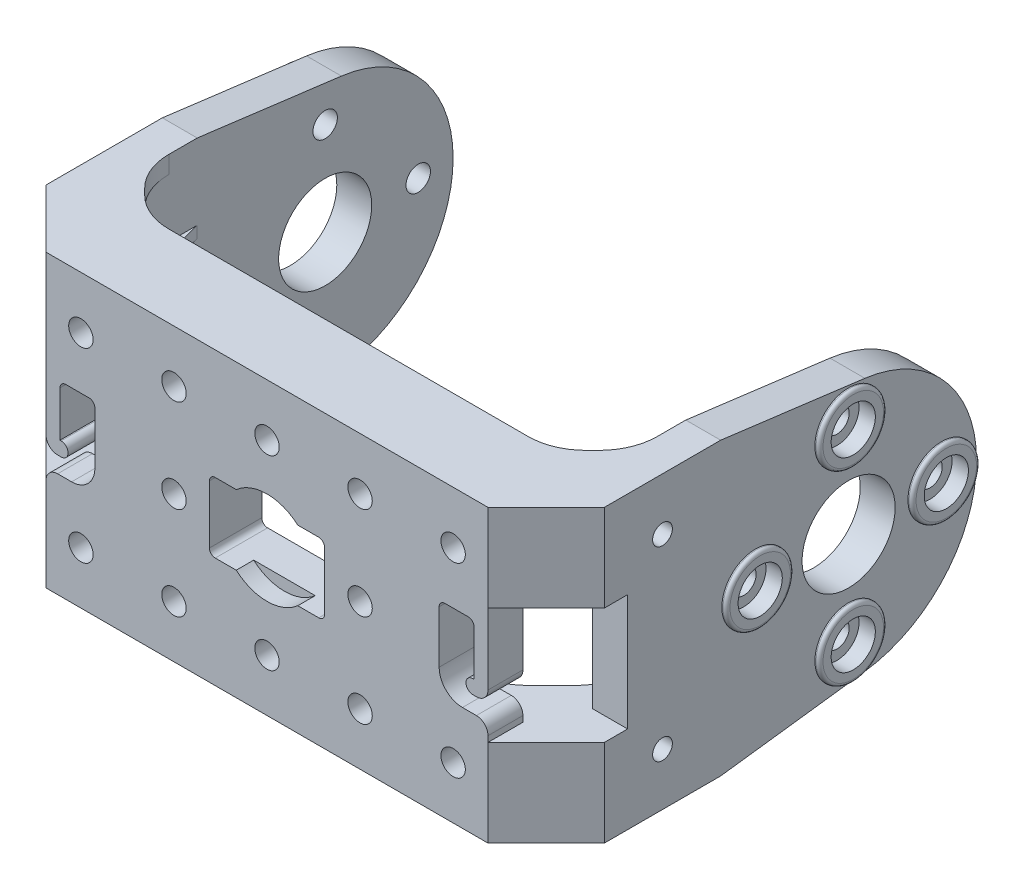
from build123d import *

# Parameters (mm, degrees)
BOSS_EXTRUDE1_DEPTH            = 1
BOSS_EXTRUDE2_DEPTH            = 0.5
CUT_EXTRUDE1_DEPTH             = 1
CUT_EXTRUDE2_DEPTH             = 1
CUT_EXTRUDE3_DEPTH             = 1
SKETCH6_W                      = 1.5
SKETCH6_H                      = 1.5
BOSS_EXTRUDE3_DEPTH            = 10.919112181
CUT_EXTRUDE4_DEPTH             = 1
BOSS_EXTRUDE4_DEPTH            = 7.5
BOSS_EXTRUDE5_DEPTH            = 7.5
CUT_EXTRUDE5_DEPTH             = 6
CUT_EXTRUDE6_DEPTH             = 6
BOSS_EXTRUDE6_DEPTH            = 3
BOSS_EXTRUDE7_START            = 3
BOSS_EXTRUDE7_DEPTH            = 3
CUT_EXTRUDE7_DEPTH             = 1.5
CUT_EXTRUDE8_DEPTH             = 1.5
CUT_EXTRUDE9_DEPTH             = 5
SKETCH17_W                     = 0.5
SKETCH17_H                     = 7
CUT_EXTRUDE10_DEPTH            = 1.743065645
CUT_EXTRUDE11_DEPTH            = 1.5
CUT_EXTRUDE12_DEPTH            = 1.5
CUT_EXTRUDE13_DEPTH            = 5
SKETCH21_W                     = 0.5
SKETCH21_H                     = 7
CUT_EXTRUDE14_DEPTH            = 2.337822174
SKETCH22_W                     = 0.5
SKETCH22_H                     = 7
CUT_EXTRUDE15_DEPTH            = 1.743065645
SKETCH23_W                     = 1.5
SKETCH23_H                     = 1.5
CUT_EXTRUDE16_DEPTH            = 8.985281374
SKETCH24_W                     = 0.5
SKETCH24_H                     = 7
CUT_EXTRUDE17_DEPTH            = 2.337822174
SKETCH25_W                     = 1.5
SKETCH25_H                     = 1.5
CUT_EXTRUDE18_DEPTH            = 0.419112181
BOSS_EXTRUDE8_DEPTH            = 3
CUT_EXTRUDE19_DEPTH            = 0.5
CUT_EXTRUDE20_DEPTH            = 1
CUT_EXTRUDE21_DEPTH            = 1
CUT_EXTRUDE22_DEPTH            = 1
CUT_EXTRUDE23_DEPTH            = 0.5
CUT_EXTRUDE24_DEPTH            = 1
CUT_EXTRUDE25_DEPTH            = 1
CUT_EXTRUDE26_DEPTH            = 1
CUT_EXTRUDE27_DEPTH            = 1
CUT_EXTRUDE28_DEPTH            = 1
CUT_EXTRUDE29_DEPTH            = 2
CUT_EXTRUDE30_DEPTH            = 1
CUT_EXTRUDE31_DEPTH            = 2
CUT_EXTRUDE32_DEPTH            = 1
CUT_EXTRUDE33_DEPTH            = 2
CUT_EXTRUDE34_DEPTH            = 1
CUT_EXTRUDE35_DEPTH            = 2
CUT_EXTRUDE36_DEPTH            = 1
CUT_EXTRUDE37_DEPTH            = 2
CUT_EXTRUDE38_DEPTH            = 1
CUT_EXTRUDE39_DEPTH            = 1
CUT_EXTRUDE40_DEPTH            = 2
CUT_EXTRUDE41_DEPTH            = 1
CUT_EXTRUDE42_DEPTH            = 1
SKETCH51_W                     = 9.9
SKETCH51_H                     = 6
CUT_EXTRUDE43_DEPTH            = 46.839393539
CUT_EXTRUDE44_DEPTH            = 1.5
CUT_EXTRUDE45_DEPTH            = 1.5
CUT_EXTRUDE46_DEPTH            = 2
CUT_EXTRUDE47_DEPTH            = 2
CUT_EXTRUDE48_DEPTH            = 2
CUT_EXTRUDE49_DEPTH            = 2
CUT_EXTRUDE50_DEPTH            = 2
CUT_EXTRUDE51_DEPTH            = 2
DRAFT1_ANGLE                   = 71.621107155
SKETCH60_W                     = 0.4
SKETCH60_H                     = 2.9
SKETCH61_W                     = 0.4
SKETCH61_H                     = 2.9
SKETCH62_W                     = 0.4
SKETCH62_H                     = 2.9
SKETCH63_W                     = 0.4
SKETCH63_H                     = 2.9
SKETCH64_W                     = 0.4
SKETCH64_H                     = 2.9
SKETCH65_W                     = 0.4
SKETCH65_H                     = 2.9
SKETCH66_W                     = 0.4
SKETCH66_H                     = 2.9
SKETCH67_W                     = 0.4
SKETCH67_H                     = 2.9
F_1_7_1_7_DIAMETER_HOLE1_D     = 1.7
F_1_7_1_7_DIAMETER_HOLE1_DEPTH = 3
F_1_7_1_7_DIAMETER_HOLE2_D     = 1.7
F_1_7_1_7_DIAMETER_HOLE2_DEPTH = 3.4
F_2_1_2_1_DIAMETER_HOLE1_D     = 2.1
F_2_1_2_1_DIAMETER_HOLE1_DEPTH = 37
HOLE1_D                        = 2.1
HOLE1_DEPTH                    = 3.4
HOLE1_CBORE_D                  = 3.8
HOLE1_CBORE_DEPTH              = 1.4
HOLE2_D                        = 2.1
HOLE2_DEPTH                    = 48.8
HOLE2_CBORE_D                  = 3.8
HOLE2_CBORE_DEPTH              = 1.4
F_8_0_8_DIAMETER_HOLE1_D       = 8
F_8_0_8_DIAMETER_HOLE1_DEPTH   = 3
F_8_0_8_DIAMETER_HOLE2_D       = 8
F_8_0_8_DIAMETER_HOLE2_DEPTH   = 3.4
CHAMFER1_SIZE                  = 5
FILLET1_R                      = 0.3
FILLET2_R                      = 0.5
FILLET3_R                      = 1
FILLET4_R                      = 2
FILLET5_R                      = 5


with BuildPart() as part:
    # Sketch1 → Boss-Extrude1 (new body)
    with BuildSketch(Plane.XY.offset(23)):
        Polygon((-14.595606444, -5), (10.080887819, -5), (10.080887819, -2.493640581), (11.2, -1.847520861), (11.2, 1.847520861), (10.080887819, 2.493640581), (10.080887819, 3.5), (14.595606444, 5), (-14.595606444, 5), (-10.080887819, 3.5), (-10.080887819, 2.493640581), (-11.2, 1.847520861), (-11.2, -1.847520861), (-10.080887819, -2.493640581), (-10.080887819, -3.5), align=None)
    extrude(amount=-BOSS_EXTRUDE1_DEPTH)

    # Sketch2 → Boss-Extrude2 (add)
    with BuildSketch(Plane(origin=(0, 0, 22), x_dir=(-1, 0, 0), z_dir=(0, 0, -1))):
        Polygon((-10.080887819, -5), (-10.080887819, 3.5), (-14.595606444, 5), (14.595606444, 5), (10.080887819, 3.5), (10.080887819, -3.5), (14.595606444, -5), align=None)
    extrude(amount=BOSS_EXTRUDE2_DEPTH)

    # Sketch3 → Cut-Extrude1 (cut)
    with BuildSketch(Plane.XY.offset(23)):
        Polygon((-8.337822174, -3.5), (-10.080887819, -2.493640581), (-10.080887819, -3.5), align=None)
    extrude(amount=-CUT_EXTRUDE1_DEPTH, mode=Mode.SUBTRACT)

    # Sketch4 → Cut-Extrude2 (cut)
    with BuildSketch(Plane.XY.offset(23)):
        Polygon((-10.080887819, 2.493640581), (-8.337822174, 3.5), (-10.080887819, 3.5), align=None)
    extrude(amount=-CUT_EXTRUDE2_DEPTH, mode=Mode.SUBTRACT)

    # Sketch5 → Cut-Extrude3 (cut)
    with BuildSketch(Plane.XY.offset(23)):
        Polygon((10.080887819, -2.493640581), (8.337822174, -3.5), (10.080887819, -3.5), align=None)
    extrude(amount=-CUT_EXTRUDE3_DEPTH, mode=Mode.SUBTRACT)

    # Sketch6 → Boss-Extrude3 (add)
    with BuildSketch(Plane(origin=(10.080887819, 0, 0), x_dir=(0, 0, -1), z_dir=(1, 0, 0))):
        with Locations((-22.25, -4.25)):
            Rectangle(SKETCH6_W, SKETCH6_H)
    extrude(amount=BOSS_EXTRUDE3_DEPTH)

    # Sketch7 → Cut-Extrude4 (cut)
    with BuildSketch(Plane.XY.offset(23)):
        Polygon((8.337822174, 3.5), (10.080887819, 2.493640581), (10.080887819, 3.5), align=None)
    extrude(amount=-CUT_EXTRUDE4_DEPTH, mode=Mode.SUBTRACT)

    # Sketch8 → Boss-Extrude4 (add)
    with BuildSketch(Plane.XZ.offset(5)):
        Polygon((-21, 11), (-21, 23), (21, 23), (21, 11), (19.5, 17.014718626), (17.514718626, 19), (-17.514718626, 19), (-19.5, 17.014718626), align=None)
    extrude(amount=BOSS_EXTRUDE4_DEPTH)

    # Sketch9 → Boss-Extrude5 (add)
    with BuildSketch(Plane(origin=(0, 5, 0), x_dir=(-1, 0, 0), z_dir=(0, 1, 0))):
        Polygon((21, 23), (21, 11), (19.5, 17.014718626), (17.514718626, 19), (-17.514718626, 19), (-19.5, 17.014718626), (-21, 11), (-21, 23), align=None)
    extrude(amount=BOSS_EXTRUDE5_DEPTH)

    # Sketch10 → Cut-Extrude5 (cut)
    with BuildSketch(Plane(origin=(0, -5, 0), x_dir=(-1, 0, 0), z_dir=(0, 1, 0))):
        Polygon((-17.514718626, 19), (17.514718626, 19), (15.014718626, 21.5), (-15.014718626, 21.5), align=None)
    extrude(amount=-CUT_EXTRUDE5_DEPTH, mode=Mode.SUBTRACT)

    # Sketch11 → Cut-Extrude6 (cut)
    with BuildSketch(Plane.XZ.offset(-5)):
        Polygon((-17.514718626, 19), (17.514718626, 19), (15.014718626, 21.5), (-15.014718626, 21.5), align=None)
    extrude(amount=-CUT_EXTRUDE6_DEPTH, mode=Mode.SUBTRACT)

    # Sketch12 → Boss-Extrude6 (add)
    with BuildSketch(Plane.ZY.offset(21)):
        with BuildLine():
            Line((23, 12.5), (23, 5))
            Line((23, 5), (19, 5))
            Line((19, 5), (19, -5))
            Line((19, -5), (23, -5))
            Line((23, -5), (23, -12.5))
            Line((23, -12.5), (11, -12.5))
            Line((11, -12.5), (-1.398557259, -10.910730388))
            ThreePointArc((-1.398557259, -10.910730388), (-11, 0), (-1.398557259, 10.910730388))
            Line((-1.398557259, 10.910730388), (11, 12.5))
            Line((11, 12.5), (23, 12.5))
        make_face()
    extrude(amount=BOSS_EXTRUDE6_DEPTH)

    # Sketch13 → Boss-Extrude7 (add)
    with BuildSketch(Plane(origin=(21, 0, 0), x_dir=(0, 0, -1), z_dir=(1, 0, 0)).offset(BOSS_EXTRUDE7_START)):
        with BuildLine():
            Line((-23, 12.5), (-11, 12.5))
            Line((-11, 12.5), (1.398557259, 10.910730388))
            ThreePointArc((1.398557259, 10.910730388), (11, 0), (1.398557259, -10.910730388))
            Line((1.398557259, -10.910730388), (-11, -12.5))
            Line((-11, -12.5), (-23, -12.5))
            Line((-23, -12.5), (-23, -3.5))
            Line((-23, -3.5), (-21.5, -3.5))
            Line((-21.5, -3.5), (-21.5, -5))
            Line((-21.5, -5), (-19, -5))
            Line((-19, -5), (-19, 5))
            Line((-19, 5), (-23, 5))
            Line((-23, 5), (-23, 12.5))
        make_face()
    extrude(amount=-BOSS_EXTRUDE7_DEPTH)

    # Sketch14 → Cut-Extrude7 (cut)
    with BuildSketch(Plane(origin=(0, 12.5, 0), x_dir=(-1, 0, 0), z_dir=(0, 1, 0))):
        Polygon((21, 11), (21, 15.514718626), (19.5, 17.014718626), align=None)
    extrude(amount=-CUT_EXTRUDE7_DEPTH, mode=Mode.SUBTRACT)

    # Sketch15 → Cut-Extrude8 (cut)
    with BuildSketch(Plane(origin=(0, 12.5, 0), x_dir=(-1, 0, 0), z_dir=(0, 1, 0))):
        Polygon((-21, 11), (-19.5, 17.014718626), (-21, 15.514718626), align=None)
    extrude(amount=-CUT_EXTRUDE8_DEPTH, mode=Mode.SUBTRACT)

    # Sketch16 → Cut-Extrude9 (cut)
    with BuildSketch(Plane(origin=(0, 11, 0), x_dir=(-1, 0, 0), z_dir=(0, 1, 0))):
        Polygon((21, 22), (-21, 22), (-21, 11), (-19.5, 17.014718626), (-15.014718626, 21.5), (15.014718626, 21.5), (19.5, 17.014718626), (21, 11), align=None)
    extrude(amount=-CUT_EXTRUDE9_DEPTH, mode=Mode.SUBTRACT)

    # Sketch17 → Cut-Extrude10 (cut)
    with BuildSketch(Plane(origin=(10.080887819, 0, 0), x_dir=(0, 0, -1), z_dir=(1, 0, 0))):
        with Locations((-21.75, 0)):
            Rectangle(SKETCH17_W, SKETCH17_H)
    extrude(amount=-CUT_EXTRUDE10_DEPTH, mode=Mode.SUBTRACT)

    # Sketch18 → Cut-Extrude11 (cut)
    with BuildSketch(Plane.XZ.offset(12.5)):
        Polygon((-19.5, 17.014718626), (-21, 15.514718626), (-21, 11), align=None)
    extrude(amount=-CUT_EXTRUDE11_DEPTH, mode=Mode.SUBTRACT)

    # Sketch19 → Cut-Extrude12 (cut)
    with BuildSketch(Plane.XZ.offset(12.5)):
        Polygon((21, 15.514718626), (19.5, 17.014718626), (21, 11), align=None)
    extrude(amount=-CUT_EXTRUDE12_DEPTH, mode=Mode.SUBTRACT)

    # Sketch20 → Cut-Extrude13 (cut)
    with BuildSketch(Plane.XZ.offset(11)):
        Polygon((21, 22), (-21, 22), (-21, 11), (-19.5, 17.014718626), (-15.014718626, 21.5), (15.014718626, 21.5), (19.5, 17.014718626), (21, 11), align=None)
    extrude(amount=-CUT_EXTRUDE13_DEPTH, mode=Mode.SUBTRACT)

    # Sketch21 → Cut-Extrude14 (cut)
    with BuildSketch(Plane(origin=(8.337822174, 0, 0), x_dir=(0, 0, -1), z_dir=(1, 0, 0))):
        with Locations((-21.75, 0)):
            Rectangle(SKETCH21_W, SKETCH21_H)
    extrude(amount=-CUT_EXTRUDE14_DEPTH, mode=Mode.SUBTRACT)

    # Sketch22 → Cut-Extrude15 (cut)
    with BuildSketch(Plane.ZY.offset(10.080887819)):
        with Locations((21.75, 0)):
            Rectangle(SKETCH22_W, SKETCH22_H)
    extrude(amount=-CUT_EXTRUDE15_DEPTH, mode=Mode.SUBTRACT)

    # Sketch23 → Cut-Extrude16 (cut)
    with BuildSketch(Plane(origin=(24, 0, 0), x_dir=(0, 0, -1), z_dir=(1, 0, 0))):
        with Locations((-22.25, -4.25)):
            Rectangle(SKETCH23_W, SKETCH23_H)
    extrude(amount=-CUT_EXTRUDE16_DEPTH, mode=Mode.SUBTRACT)

    # Sketch24 → Cut-Extrude17 (cut)
    with BuildSketch(Plane.ZY.offset(8.337822174)):
        with Locations((21.75, 0)):
            Rectangle(SKETCH24_W, SKETCH24_H)
    extrude(amount=-CUT_EXTRUDE17_DEPTH, mode=Mode.SUBTRACT)

    # Sketch25 → Cut-Extrude18 (cut)
    with BuildSketch(Plane(origin=(15.014718626, 0, 0), x_dir=(0, 0, -1), z_dir=(1, 0, 0))):
        with Locations((-22.25, -4.25)):
            Rectangle(SKETCH25_W, SKETCH25_H)
    extrude(amount=-CUT_EXTRUDE18_DEPTH, mode=Mode.SUBTRACT)

    # Sketch26 → Boss-Extrude8 (add)
    with BuildSketch(Plane.XY.offset(23)):
        with BuildLine():
            Line((14.8, 3.5), (14.8, -3.5))
            Line((14.8, -3.5), (19, -3.5))
            Line((19, -3.5), (19, -5))
            Line((19, -5), (24, -5))
            Line((24, -5), (24, -12.5))
            Line((24, -12.5), (-24, -12.5))
            Line((-24, -12.5), (-24, -5))
            Line((-24, -5), (-19, -5))
            Line((-19, -5), (-19, -3.5))
            Line((-19, -3.5), (-14.8, -3.5))
            Line((-14.8, -3.5), (-14.8, 3.5))
            Line((-14.8, 3.5), (-17.8, 3.5))
            Line((-17.8, 3.5), (-17.8, -0.9))
            Line((-17.8, -0.9), (-17.7, -0.9))
            ThreePointArc((-17.7, -0.9), (-17.1, -1.5), (-17.7, -2.1))
            Line((-17.7, -2.1), (-19, -2.1))
            Line((-19, -2.1), (-19, 5))
            Line((-19, 5), (-24, 5))
            Line((-24, 5), (-24, 12.5))
            Line((-24, 12.5), (24, 12.5))
            Line((24, 12.5), (24, 5))
            Line((24, 5), (19, 5))
            Line((19, 5), (19, -2.1))
            Line((19, -2.1), (17.7, -2.1))
            ThreePointArc((17.7, -2.1), (17.1, -1.5), (17.7, -0.9))
            Line((17.7, -0.9), (17.8, -0.9))
            Line((17.8, -0.9), (17.8, 3.5))
            Line((17.8, 3.5), (14.8, 3.5))
        make_face()
    extrude(amount=BOSS_EXTRUDE8_DEPTH)

    # Sketch27 → Cut-Extrude19 (cut)
    with BuildSketch(Plane(origin=(0, 0, 21.5), x_dir=(-1, 0, 0), z_dir=(0, 0, -1))):
        Polygon((-9.919112181, 4.5), (9.919112181, 4.5), (14.433830807, 6), (-14.433830807, 6), align=None)
    extrude(amount=-CUT_EXTRUDE19_DEPTH, mode=Mode.SUBTRACT)

    # Sketch28 → Cut-Extrude20 (cut)
    with BuildSketch(Plane(origin=(0, 0, 22), x_dir=(-1, 0, 0), z_dir=(0, 0, -1))):
        Polygon((9.919112181, 4.5), (13.810221356, 5.792807868), (12.535898385, 8), (14.267949192, 11), (9.203847577, 11), (11.2, 9.847520861), (11.2, 6.152479139), (8.337822174, 4.5), align=None)
    extrude(amount=-CUT_EXTRUDE20_DEPTH, mode=Mode.SUBTRACT)

    # Sketch29 → Cut-Extrude21 (cut)
    with BuildSketch(Plane(origin=(0, 0, 22), x_dir=(-1, 0, 0), z_dir=(0, 0, -1))):
        Polygon((7.662177826, 4.5), (4.8, 6.152479139), (4.8, 9.847520861), (6.796152423, 11), (1.203847577, 11), (3.2, 9.847520861), (3.2, 6.152479139), (0.337822174, 4.5), align=None)
    extrude(amount=-CUT_EXTRUDE21_DEPTH, mode=Mode.SUBTRACT)

    # Sketch30 → Cut-Extrude22 (cut)
    with BuildSketch(Plane(origin=(0, 0, 22), x_dir=(-1, 0, 0), z_dir=(0, 0, -1))):
        Polygon((-8.337822174, 4.5), (-11.2, 6.152479139), (-11.2, 9.847520861), (-9.203847577, 11), (-14.267949192, 11), (-12.535898385, 8), (-13.810221356, 5.792807868), (-9.919112181, 4.5), align=None)
    extrude(amount=-CUT_EXTRUDE22_DEPTH, mode=Mode.SUBTRACT)

    # Sketch31 → Cut-Extrude23 (cut)
    with BuildSketch(Plane(origin=(0, 0, 21.5), x_dir=(-1, 0, 0), z_dir=(0, 0, -1))):
        Polygon((9.919112181, -4.5), (-9.919112181, -4.5), (-14.433830807, -6), (14.433830807, -6), align=None)
    extrude(amount=-CUT_EXTRUDE23_DEPTH, mode=Mode.SUBTRACT)

    # Sketch32 → Cut-Extrude24 (cut)
    with BuildSketch(Plane(origin=(0, 0, 22), x_dir=(-1, 0, 0), z_dir=(0, 0, -1))):
        Polygon((-7.662177826, -4.5), (-4.8, -6.152479139), (-4.8, -9.847520861), (-6.796152423, -11), (-1.203847577, -11), (-3.2, -9.847520861), (-3.2, -6.152479139), (-0.337822174, -4.5), align=None)
    extrude(amount=-CUT_EXTRUDE24_DEPTH, mode=Mode.SUBTRACT)

    # Sketch33 → Cut-Extrude25 (cut)
    with BuildSketch(Plane(origin=(0, 0, 22), x_dir=(-1, 0, 0), z_dir=(0, 0, -1))):
        Polygon((-9.919112181, -4.5), (-13.810221356, -5.792807868), (-12.535898385, -8), (-14.267949192, -11), (-9.203847577, -11), (-11.2, -9.847520861), (-11.2, -6.152479139), (-8.337822174, -4.5), align=None)
    extrude(amount=-CUT_EXTRUDE25_DEPTH, mode=Mode.SUBTRACT)

    # Sketch34 → Cut-Extrude26 (cut)
    with BuildSketch(Plane(origin=(0, 0, 22), x_dir=(-1, 0, 0), z_dir=(0, 0, -1))):
        Polygon((-0.337822174, 4.5), (-3.2, 6.152479139), (-3.2, 9.847520861), (-1.203847577, 11), (-6.796152423, 11), (-4.8, 9.847520861), (-4.8, 6.152479139), (-7.662177826, 4.5), align=None)
    extrude(amount=-CUT_EXTRUDE26_DEPTH, mode=Mode.SUBTRACT)

    # Sketch35 → Cut-Extrude27 (cut)
    with BuildSketch(Plane(origin=(0, 0, 22), x_dir=(-1, 0, 0), z_dir=(0, 0, -1))):
        Polygon((8.337822174, -4.5), (11.2, -6.152479139), (11.2, -9.847520861), (9.203847577, -11), (14.267949192, -11), (12.535898385, -8), (13.810221356, -5.792807868), (9.919112181, -4.5), align=None)
    extrude(amount=-CUT_EXTRUDE27_DEPTH, mode=Mode.SUBTRACT)

    # Sketch36 → Cut-Extrude28 (cut)
    with BuildSketch(Plane(origin=(0, 0, 22), x_dir=(-1, 0, 0), z_dir=(0, 0, -1))):
        Polygon((0.337822174, -4.5), (3.2, -6.152479139), (3.2, -9.847520861), (1.203847577, -11), (6.796152423, -11), (4.8, -9.847520861), (4.8, -6.152479139), (7.662177826, -4.5), align=None)
    extrude(amount=-CUT_EXTRUDE28_DEPTH, mode=Mode.SUBTRACT)

    # Sketch37 → Cut-Extrude29 (cut)
    with BuildSketch(Plane(origin=(0, 0, 22), x_dir=(-1, 0, 0), z_dir=(0, 0, -1))):
        Polygon((-13.690598923, -8), (-14.845299462, -6), (-17.154700538, -6), (-18.309401077, -8), (-17.154700538, -10), (-14.845299462, -10), align=None)
    extrude(amount=-CUT_EXTRUDE29_DEPTH, mode=Mode.SUBTRACT)

    # Sketch38 → Cut-Extrude30 (cut)
    with BuildSketch(Plane(origin=(0, 0, 22), x_dir=(-1, 0, 0), z_dir=(0, 0, -1))):
        Polygon((-17.732050808, -11), (-19.464101615, -8), (-18.309401077, -6), (-21, -6), (-21, -11), align=None)
    extrude(amount=-CUT_EXTRUDE30_DEPTH, mode=Mode.SUBTRACT)

    # Sketch39 → Cut-Extrude31 (cut)
    with BuildSketch(Plane(origin=(0, 0, 22), x_dir=(-1, 0, 0), z_dir=(0, 0, -1))):
        Polygon((-14.845299462, 10), (-17.154700538, 10), (-18.309401077, 8), (-17.154700538, 6), (-14.845299462, 6), (-13.690598923, 8), align=None)
    extrude(amount=-CUT_EXTRUDE31_DEPTH, mode=Mode.SUBTRACT)

    # Sketch40 → Cut-Extrude32 (cut)
    with BuildSketch(Plane(origin=(0, 0, 22), x_dir=(-1, 0, 0), z_dir=(0, 0, -1))):
        Polygon((-17.732050808, 11), (-21, 11), (-21, 6), (-18.309401077, 6), (-19.464101615, 8), align=None)
    extrude(amount=-CUT_EXTRUDE32_DEPTH, mode=Mode.SUBTRACT)

    # Sketch41 → Cut-Extrude33 (cut)
    with BuildSketch(Plane(origin=(0, 0, 22), x_dir=(-1, 0, 0), z_dir=(0, 0, -1))):
        Polygon((13.690598923, 8), (14.845299462, 6), (17.154700538, 6), (18.309401077, 8), (17.154700538, 10), (14.845299462, 10), align=None)
    extrude(amount=-CUT_EXTRUDE33_DEPTH, mode=Mode.SUBTRACT)

    # Sketch42 → Cut-Extrude34 (cut)
    with BuildSketch(Plane(origin=(0, 0, 22), x_dir=(-1, 0, 0), z_dir=(0, 0, -1))):
        Polygon((17.732050808, 11), (19.464101615, 8), (18.309401077, 6), (21, 6), (21, 11), align=None)
    extrude(amount=-CUT_EXTRUDE34_DEPTH, mode=Mode.SUBTRACT)

    # Sketch43 → Cut-Extrude35 (cut)
    with BuildSketch(Plane(origin=(0, 0, 22), x_dir=(-1, 0, 0), z_dir=(0, 0, -1))):
        Polygon((14.845299462, -10), (17.154700538, -10), (18.309401077, -8), (17.154700538, -6), (14.845299462, -6), (13.690598923, -8), align=None)
    extrude(amount=-CUT_EXTRUDE35_DEPTH, mode=Mode.SUBTRACT)

    # Sketch44 → Cut-Extrude36 (cut)
    with BuildSketch(Plane(origin=(0, 0, 22), x_dir=(-1, 0, 0), z_dir=(0, 0, -1))):
        Polygon((17.732050808, -11), (21, -11), (21, -6), (18.309401077, -6), (19.464101615, -8), align=None)
    extrude(amount=-CUT_EXTRUDE36_DEPTH, mode=Mode.SUBTRACT)

    # Sketch45 → Cut-Extrude37 (cut)
    with BuildSketch(Plane(origin=(0, 0, 22), x_dir=(-1, 0, 0), z_dir=(0, 0, -1))):
        Polygon((-8, 2.309401077), (-10, 1.154700538), (-10, -1.154700538), (-8, -2.309401077), (-6, -1.154700538), (-6, 1.154700538), align=None)
    extrude(amount=-CUT_EXTRUDE37_DEPTH, mode=Mode.SUBTRACT)

    # Sketch46 → Cut-Extrude38 (cut)
    with BuildSketch(Plane(origin=(0, 0, 22), x_dir=(-1, 0, 0), z_dir=(0, 0, -1))):
        Polygon((-6, 3.5), (-7.662177826, 3.5), (-6, 2.540341184), align=None)
    extrude(amount=-CUT_EXTRUDE38_DEPTH, mode=Mode.SUBTRACT)

    # Sketch47 → Cut-Extrude39 (cut)
    with BuildSketch(Plane(origin=(0, 0, 22), x_dir=(-1, 0, 0), z_dir=(0, 0, -1))):
        Polygon((-6, -2.540341184), (-7.662177826, -3.5), (-6, -3.5), align=None)
    extrude(amount=-CUT_EXTRUDE39_DEPTH, mode=Mode.SUBTRACT)

    # Sketch48 → Cut-Extrude40 (cut)
    with BuildSketch(Plane(origin=(0, 0, 22), x_dir=(-1, 0, 0), z_dir=(0, 0, -1))):
        Polygon((8, 2.309401077), (6, 1.154700538), (6, -1.154700538), (8, -2.309401077), (10, -1.154700538), (10, 1.154700538), align=None)
    extrude(amount=-CUT_EXTRUDE40_DEPTH, mode=Mode.SUBTRACT)

    # Sketch49 → Cut-Extrude41 (cut)
    with BuildSketch(Plane(origin=(0, 0, 22), x_dir=(-1, 0, 0), z_dir=(0, 0, -1))):
        Polygon((6, -3.5), (7.662177826, -3.5), (6, -2.540341184), align=None)
    extrude(amount=-CUT_EXTRUDE41_DEPTH, mode=Mode.SUBTRACT)

    # Sketch50 → Cut-Extrude42 (cut)
    with BuildSketch(Plane(origin=(0, 0, 22), x_dir=(-1, 0, 0), z_dir=(0, 0, -1))):
        Polygon((6, 2.540341184), (7.662177826, 3.5), (6, 3.5), align=None)
    extrude(amount=-CUT_EXTRUDE42_DEPTH, mode=Mode.SUBTRACT)

    # Sketch51 → Cut-Extrude43 (cut, through all)
    with BuildSketch(Plane.XY.offset(26)):
        Rectangle(SKETCH51_W, SKETCH51_H)
    extrude(amount=-CUT_EXTRUDE43_DEPTH, mode=Mode.SUBTRACT)

    # Sketch52 → Cut-Extrude44 (cut)
    with BuildSketch(Plane.XY.offset(26)):
        with BuildLine():
            Line((2.645751311, -3), (-2.645751311, -3))
            ThreePointArc((-2.645751311, -3), (0, -4), (2.645751311, -3))
        make_face()
    extrude(amount=-CUT_EXTRUDE44_DEPTH, mode=Mode.SUBTRACT)

    # Sketch53 → Cut-Extrude45 (cut)
    with BuildSketch(Plane.XY.offset(26)):
        with BuildLine():
            Line((-2.645751311, 3), (2.645751311, 3))
            ThreePointArc((2.645751311, 3), (0, 4), (-2.645751311, 3))
        make_face()
    extrude(amount=-CUT_EXTRUDE45_DEPTH, mode=Mode.SUBTRACT)

    # Sketch54 → Cut-Extrude46 (cut)
    with BuildSketch(Plane(origin=(0, 0, 22), x_dir=(-1, 0, 0), z_dir=(0, 0, -1))):
        Polygon((2, -6.845299462), (0, -5.690598923), (-2, -6.845299462), (-2, -9.154700538), (0, -10.309401077), (2, -9.154700538), align=None)
    extrude(amount=-CUT_EXTRUDE46_DEPTH, mode=Mode.SUBTRACT)

    # Sketch55 → Cut-Extrude47 (cut)
    with BuildSketch(Plane(origin=(0, 0, 22), x_dir=(-1, 0, 0), z_dir=(0, 0, -1))):
        Polygon((-6, 9.154700538), (-8, 10.309401077), (-10, 9.154700538), (-10, 6.845299462), (-8, 5.690598923), (-6, 6.845299462), align=None)
    extrude(amount=-CUT_EXTRUDE47_DEPTH, mode=Mode.SUBTRACT)

    # Sketch56 → Cut-Extrude48 (cut)
    with BuildSketch(Plane(origin=(0, 0, 22), x_dir=(-1, 0, 0), z_dir=(0, 0, -1))):
        Polygon((2, 9.154700538), (0, 10.309401077), (-2, 9.154700538), (-2, 6.845299462), (0, 5.690598923), (2, 6.845299462), align=None)
    extrude(amount=-CUT_EXTRUDE48_DEPTH, mode=Mode.SUBTRACT)

    # Sketch57 → Cut-Extrude49 (cut)
    with BuildSketch(Plane(origin=(0, 0, 22), x_dir=(-1, 0, 0), z_dir=(0, 0, -1))):
        Polygon((10, 9.154700538), (8, 10.309401077), (6, 9.154700538), (6, 6.845299462), (8, 5.690598923), (10, 6.845299462), align=None)
    extrude(amount=-CUT_EXTRUDE49_DEPTH, mode=Mode.SUBTRACT)

    # Sketch58 → Cut-Extrude50 (cut)
    with BuildSketch(Plane(origin=(0, 0, 22), x_dir=(-1, 0, 0), z_dir=(0, 0, -1))):
        Polygon((10, -6.845299462), (8, -5.690598923), (6, -6.845299462), (6, -9.154700538), (8, -10.309401077), (10, -9.154700538), align=None)
    extrude(amount=-CUT_EXTRUDE50_DEPTH, mode=Mode.SUBTRACT)

    # Sketch59 → Cut-Extrude51 (cut)
    with BuildSketch(Plane(origin=(0, 0, 22), x_dir=(-1, 0, 0), z_dir=(0, 0, -1))):
        Polygon((-6, -6.845299462), (-8, -5.690598923), (-10, -6.845299462), (-10, -9.154700538), (-8, -10.309401077), (-6, -9.154700538), align=None)
    extrude(amount=-CUT_EXTRUDE51_DEPTH, mode=Mode.SUBTRACT)

    # Draft1
    draft1_faces = [part.faces().sort_by_distance(p)[0] for p in [
        (14.595606444, -4.25, 22.25),
    ]]
    draft(draft1_faces, Plane.ZX.offset(-5), DRAFT1_ANGLE)

    # Sketch60 → Revolve1 (revolve)
    with BuildSketch(Plane.XY):
        with Locations((24.2, 9.45)):
            Rectangle(SKETCH60_W, SKETCH60_H)
    revolve(axis=Axis((24, 8, 0), (1, 0, 0)))

    # Sketch61 → Revolve2 (revolve)
    with BuildSketch(Plane.XY.offset(-8)):
        with Locations((24.2, 1.45)):
            Rectangle(SKETCH61_W, SKETCH61_H)
    revolve(axis=Axis((24, 0, -8), (1, 0, 0)))

    # Sketch62 → Revolve3 (revolve)
    with BuildSketch(Plane.XY):
        with Locations((24.2, -6.55)):
            Rectangle(SKETCH62_W, SKETCH62_H)
    revolve(axis=Axis((24, -8, 0), (1, 0, 0)))

    # Sketch63 → Revolve4 (revolve)
    with BuildSketch(Plane.XY.offset(8)):
        with Locations((24.2, 1.45)):
            Rectangle(SKETCH63_W, SKETCH63_H)
    revolve(axis=Axis((24, 0, 8), (1, 0, 0)))

    # Sketch64 → Revolve5 (revolve)
    with BuildSketch(Plane(origin=(0, 0, -8), x_dir=(-1, 0, 0), z_dir=(0, 0, -1))):
        with Locations((24.2, 1.45)):
            Rectangle(SKETCH64_W, SKETCH64_H)
    revolve(axis=Axis((-24, 0, -8), (-1, 0, 0)))

    # Sketch65 → Revolve6 (revolve)
    with BuildSketch(Plane(origin=(0, 0, 0), x_dir=(-1, 0, 0), z_dir=(0, 0, -1))):
        with Locations((24.2, 9.45)):
            Rectangle(SKETCH65_W, SKETCH65_H)
    revolve(axis=Axis((-24, 8, 0), (-1, 0, 0)))

    # Sketch66 → Revolve7 (revolve)
    with BuildSketch(Plane(origin=(0, 0, 8), x_dir=(-1, 0, 0), z_dir=(0, 0, -1))):
        with Locations((24.2, 1.45)):
            Rectangle(SKETCH66_W, SKETCH66_H)
    revolve(axis=Axis((-24, 0, 8), (-1, 0, 0)))

    # Sketch67 → Revolve8 (revolve)
    with BuildSketch(Plane(origin=(0, 0, 0), x_dir=(-1, 0, 0), z_dir=(0, 0, -1))):
        with Locations((24.2, -6.55)):
            Rectangle(SKETCH67_W, SKETCH67_H)
    revolve(axis=Axis((-24, -8, 0), (-1, 0, 0)))

    # Ø1.7 (1.7) Diameter Hole1
    with Locations(Plane(origin=(24, 0, 0), x_dir=(0, 0, -1), z_dir=(1, 0, 0))):
        with Locations((-16, -8), (-16, 8)):
            Hole(F_1_7_1_7_DIAMETER_HOLE1_D / 2, depth=F_1_7_1_7_DIAMETER_HOLE1_DEPTH)

    # Ø1.7 (1.7) Diameter Hole2
    with Locations(Plane(origin=(-21, 0, 0), x_dir=(0, 0, -1), z_dir=(1, 0, 0))):
        with Locations((-16, -8), (-16, 8)):
            Hole(F_1_7_1_7_DIAMETER_HOLE2_D / 2, depth=F_1_7_1_7_DIAMETER_HOLE2_DEPTH)

    # Ø2.1 (2.1) Diameter Hole1
    with Locations(Plane.XY.offset(26)):
        with Locations((0, -8), (8, 8), (0, 8), (-8, 8), (-8, -8), (8, -8), (-16, 8), (8, 0), (16, 8), (16, -8), (-8, 0), (-16, -8)):
            Hole(F_2_1_2_1_DIAMETER_HOLE1_D / 2, depth=F_2_1_2_1_DIAMETER_HOLE1_DEPTH)

    # Hole1
    with Locations(Plane(origin=(24.4, 0, 0), x_dir=(0, 0, -1), z_dir=(1, 0, 0))):
        with Locations((-8, 0), (0, -8), (8, 0), (0, 8)):
            CounterBoreHole(HOLE1_D / 2, HOLE1_CBORE_D / 2, HOLE1_CBORE_DEPTH, depth=HOLE1_DEPTH)

    # Hole2
    with Locations(Plane.ZY.offset(24.4)):
        with Locations((8, 0), (0, -8), (0, 8), (-8, 0)):
            CounterBoreHole(HOLE2_D / 2, HOLE2_CBORE_D / 2, HOLE2_CBORE_DEPTH, depth=HOLE2_DEPTH)

    # Ø8.0 (8) Diameter Hole1
    with Locations(Plane(origin=(24, 0, 0), x_dir=(0, 0, -1), z_dir=(1, 0, 0))):
        with Locations((0, 0)):
            Hole(F_8_0_8_DIAMETER_HOLE1_D / 2, depth=F_8_0_8_DIAMETER_HOLE1_DEPTH)

    # Ø8.0 (8) Diameter Hole2
    with Locations(Plane(origin=(-21, 0, 0), x_dir=(0, 0, -1), z_dir=(1, 0, 0))):
        with Locations((0, 0)):
            Hole(F_8_0_8_DIAMETER_HOLE2_D / 2, depth=F_8_0_8_DIAMETER_HOLE2_DEPTH)

    # Chamfer1
    chamfer1_edges = [part.edges().sort_by_distance(p)[0] for p in [
        (-24, 8.75, 26),
        (-24, -8.75, 26),
        (24, 8.75, 26),
        (24, -8.75, 26),
    ]]
    chamfer(chamfer1_edges, length=CHAMFER1_SIZE)

    # Fillet1
    fillet1_edges = [part.edges().sort_by_distance(p)[0] for p in [
        (24.4, -10.9, 0),
        (-24.4, 5.1, 0),
        (-24.4, -2.9, 8),
        (-24.4, -10.9, 0),
        (-24.4, -2.9, -8),
        (24.4, -2.9, -8),
        (24.4, 5.1, 0),
        (24.4, -2.9, 8),
    ]]
    fillet(fillet1_edges, radius=FILLET1_R)

    # Fillet2
    fillet2_edges = [part.edges().sort_by_distance(p)[0] for p in [
        (-4.95, 3, 23.75),
        (17.8, 3.5, 24.5),
        (4.95, -3, 23.75),
        (-4.95, -3, 23.75),
        (14.8, 3.5, 24.5),
        (-17.8, 3.5, 24.5),
        (-14.8, 3.5, 24.5),
        (4.95, 3, 23.75),
    ]]
    fillet(fillet2_edges, radius=FILLET2_R)

    # Fillet3
    fillet3_edges = [part.edges().sort_by_distance(p)[0] for p in [
        (19, -2.1, 24.5),
        (19, -3.5, 24.5),
        (-19, -3.5, 24.5),
        (-19, -2.1, 24.5),
    ]]
    fillet(fillet3_edges, radius=FILLET3_R)

    # Fillet4
    fillet4_edges = [part.edges().sort_by_distance(p)[0] for p in [
        (14.8, -3.5, 24.5),
        (-14.8, -3.5, 24.5),
    ]]
    fillet(fillet4_edges, radius=FILLET4_R)

    # Fillet5
    fillet5_edges = [part.edges().sort_by_distance(p)[0] for p in [
        (-15.014718626, -5.5, 21.5),
        (15.014718626, -5.5, 21.5),
        (-19.5, 5.5, 17.014718626),
        (-19.5, -5.5, 17.014718626),
        (15.014718626, 5.5, 21.5),
        (21, -11.75, 15.514718626),
        (-21, 11.75, 15.514718626),
        (17.514718626, -11.75, 19),
        (-15.014718626, 5.5, 21.5),
        (-17.514718626, -11.75, 19),
        (19.5, -5.5, 17.014718626),
        (21, 11.75, 15.514718626),
        (19.5, 5.5, 17.014718626),
        (17.514718626, 11.75, 19),
        (-17.514718626, 11.75, 19),
        (-21, -11.75, 15.514718626),
    ]]
    fillet(fillet5_edges, radius=FILLET5_R)


solid = part.part
